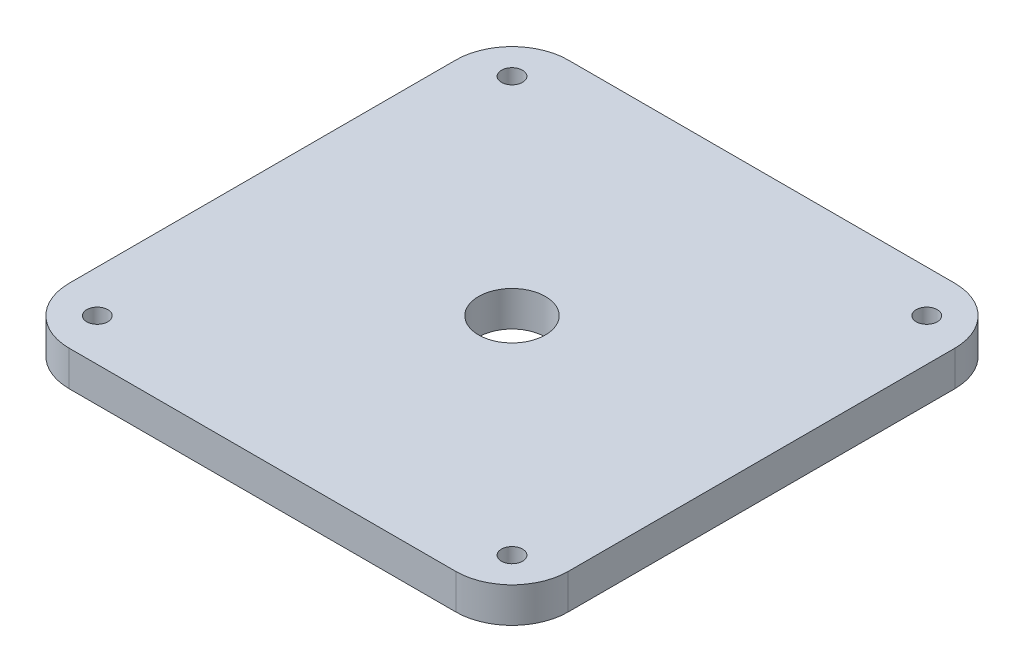
from build123d import *

# Parameters (mm, degrees)
SKETCH1_W           = 71
SKETCH1_H           = 71
SKETCH1_R           = 1.5
SKETCH1_R_2         = 4.75
BOSS_EXTRUDE1_DEPTH = 5
FILLET1_R           = 8


with BuildPart() as part:
    # Sketch1 → Boss-Extrude1 (new body)
    with BuildSketch(Plane(origin=(0, 0, 0), x_dir=(1, 0, 0), z_dir=(0, 1, 0))):
        with Locations((35.5, 35.5)):
            Rectangle(SKETCH1_W, SKETCH1_H)
        with Locations((6, 6)):
            Circle(SKETCH1_R, mode=Mode.SUBTRACT)
        with Locations((65, 6)):
            Circle(SKETCH1_R, mode=Mode.SUBTRACT)
        with Locations((65, 65)):
            Circle(SKETCH1_R, mode=Mode.SUBTRACT)
        with Locations((6, 65)):
            Circle(SKETCH1_R, mode=Mode.SUBTRACT)
        with Locations((35.5, 35.5)):
            Circle(SKETCH1_R_2, mode=Mode.SUBTRACT)
    extrude(amount=BOSS_EXTRUDE1_DEPTH)

    # Fillet1
    fillet1_edges = [part.edges().sort_by_distance(p)[0] for p in [
        (0, 2.5, -71),
        (71, 2.5, -71),
        (0, 2.5, 0),
        (71, 2.5, 0),
    ]]
    fillet(fillet1_edges, radius=FILLET1_R)


solid = part.part
